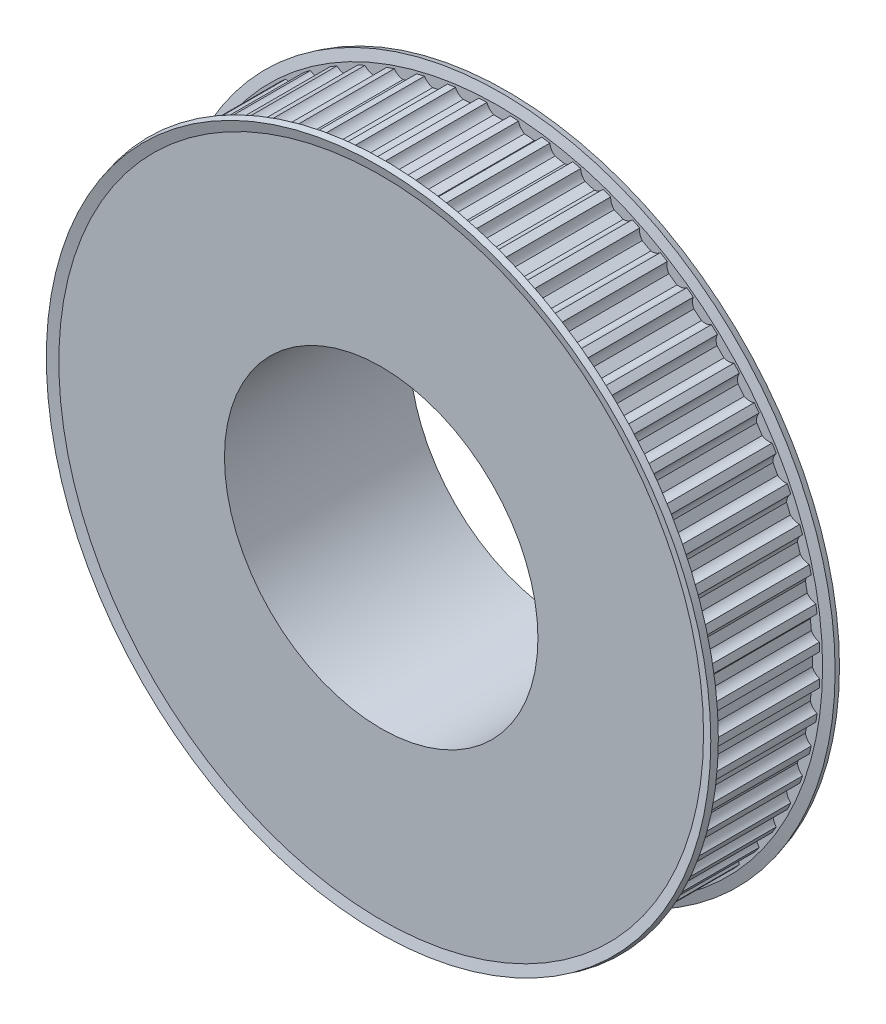
from build123d import *

# Parameters (mm, degrees)
CUT_EXTRUDE1_DEPTH = 120.265334444
CIRPATTERN1_COUNT  = 64


with BuildPart() as part:
    # Sketch1 → Revolve1 (revolve)
    with BuildSketch(Plane(origin=(0, 0, 0), x_dir=(0, 0, -1), z_dir=(1, 0, 0))):
        Polygon((0, 38.1), (45, 38.1), (45, 53.6), (30, 53.6), (30, 78.1), (0, 78.1), align=None)
    revolve(axis=Axis((0, 0, 181.280788177), (0, 0, -1)))

    # Sketch2 → Cut-Extrude1 (cut, through all)
    with BuildSketch(Plane.XY):
        with BuildLine():
            Line((-1.198957881, 76.25), (1.198957881, 76.25))
            ThreePointArc((1.198957881, 76.25), (2.331759211, 77.112435701), (2.939387691, 78.4))
            ThreePointArc((2.939387691, 78.4), (3.199892965, 78.830947502), (3.674234614, 79))
            Line((3.674234614, 79), (3.75, 79))
            Line((3.75, 79), (3.75, 81))
            Line((3.75, 81), (-3.75, 81))
            Line((-3.75, 81), (-3.75, 79))
            Line((-3.75, 79), (-3.674234614, 79))
            ThreePointArc((-3.674234614, 79), (-3.199892965, 78.830947502), (-2.939387691, 78.4))
            ThreePointArc((-2.939387691, 78.4), (-2.331759211, 77.112435701), (-1.198957881, 76.25))
        make_face()
    cut_extrude1 = extrude(amount=-CUT_EXTRUDE1_DEPTH, mode=Mode.SUBTRACT)

    # CirPattern1: Cut-Extrude1 ×64 about axis
    cirpattern1_axis = Axis((0, 0, 181.280788177), (0, 0, 1))
    for i in range(1, CIRPATTERN1_COUNT):
        add(cut_extrude1.rotate(cirpattern1_axis, i * 360 / CIRPATTERN1_COUNT), mode=Mode.SUBTRACT)

    # Sketch3 → Revolve2 (revolve)
    with BuildSketch(Plane(origin=(0, 0, 0), x_dir=(0, 0, -1), z_dir=(1, 0, 0))):
        Polygon((1.448888739, 73.748164557), (1.448888739, 78.748164557), (0.805810678, 81.148164557), (-0.643078062, 80.759935989), (0, 78.359935989), (0, 73.748164557), align=None)
        Polygon((28.551111261, 73.748164557), (30, 73.748164557), (30, 78.359935989), (30.643078062, 80.759935989), (29.194189322, 81.148164557), (28.551111261, 78.748164557), align=None)
    revolve(axis=Axis((0, 0, 34.41325723), (0, 0, -1)))


solid = part.part
